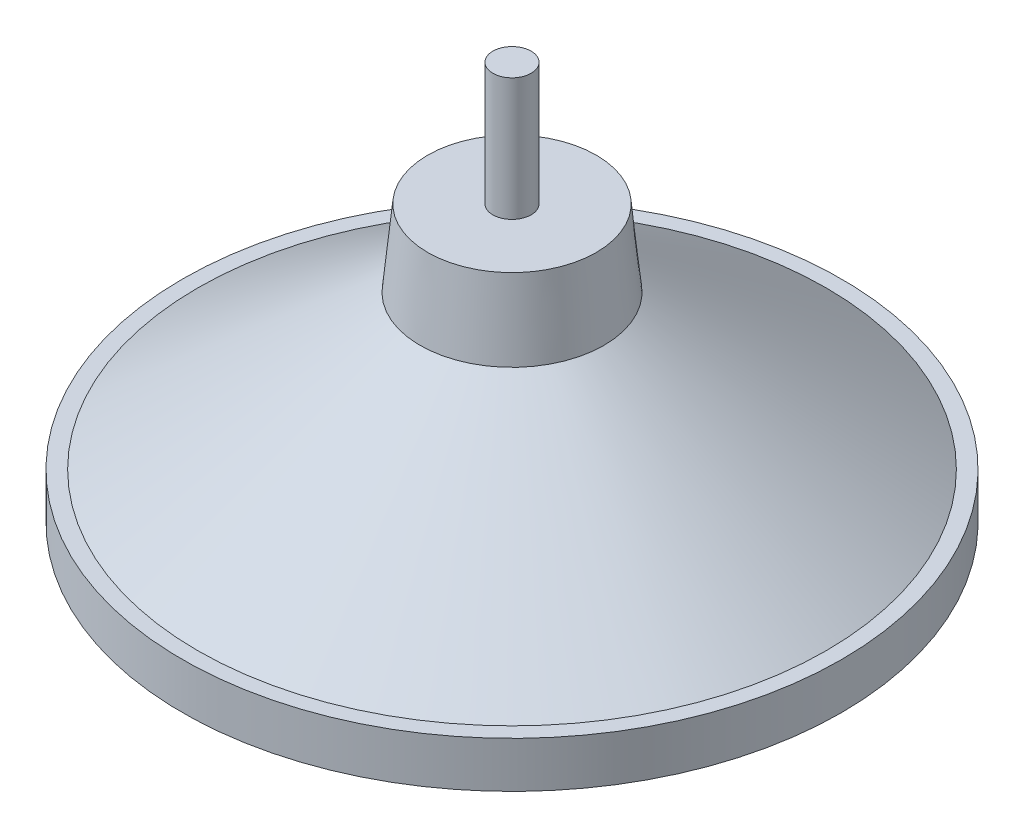
from build123d import *


with BuildPart() as part:
    # Sketch1 → Revolve1 (revolve)
    with BuildSketch(Plane.XY):
        Polygon((0, 0), (68.2625, 0), (68.2625, 9.525), (65.0875, 9.525), (19.05, 41.275), (17.4625, 57.15), (3.96875, 57.15), (3.96875, 82.55), (0, 82.55), (0, 57.15), align=None)
    revolve(axis=Axis((0, 57.15, 0), (0, -1, 0)))


solid = part.part
